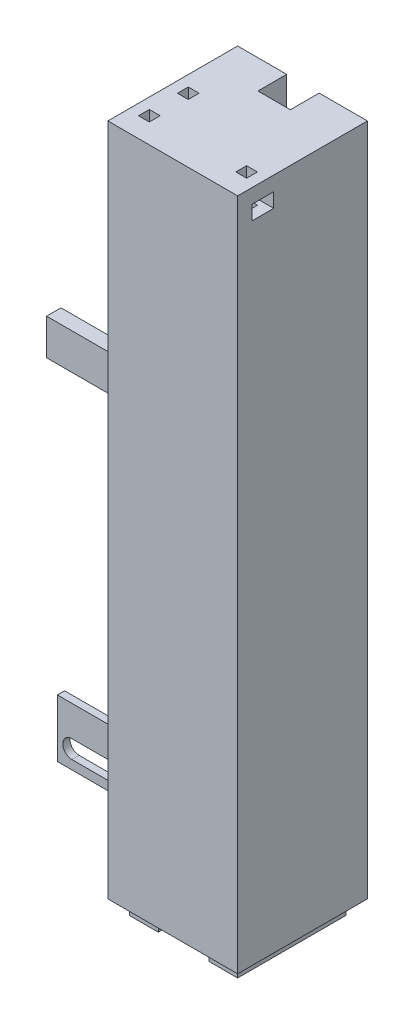
from build123d import *

# Parameters (mm, degrees)
SKETCH1_W           = 36
SKETCH1_H           = 36
BOSS_EXTRUDE1_DEPTH = 186.9
BOSS_EXTRUDE2_DEPTH = 4
SKETCH3_R           = 2
CUT_EXTRUDE1_DEPTH  = 5
SKETCH4_W           = 9
SKETCH4_H           = 186.9
CUT_EXTRUDE2_DEPTH  = 8
SKETCH5_W           = 6
SKETCH5_H           = 4
CUT_EXTRUDE3_DEPTH  = 9
SKETCH6_W           = 3
SKETCH6_H           = 3
CUT_EXTRUDE4_DEPTH  = 10
SKETCH7_W           = 2
SKETCH7_H           = 16
BOSS_EXTRUDE3_DEPTH = 40
CUT_EXTRUDE5_REACH  = 194.893
SKETCH9_W           = 4
SKETCH9_H           = 10
BOSS_EXTRUDE4_DEPTH = 45
CHAMFER1_SIZE       = 20
CUT_EXTRUDE6_DEPTH  = 27
SKETCH11_W          = 6
SKETCH11_H          = 4
SKETCH11_H_2        = 6
CUT_EXTRUDE7_DEPTH  = 9
SKETCH12_W          = 3
SKETCH12_H          = 3
CUT_EXTRUDE8_DEPTH  = 10


with BuildPart() as part:
    # Sketch1 → Boss-Extrude1 (new body)
    with BuildSketch(Plane(origin=(0, 0, 0), x_dir=(1, 0, 0), z_dir=(0, 1, 0))):
        with Locations((18, 18)):
            Rectangle(SKETCH1_W, SKETCH1_H)
    extrude(amount=BOSS_EXTRUDE1_DEPTH)

    # Sketch2 → Boss-Extrude2 (add)
    with BuildSketch(Plane.XZ):
        Polygon((3, -3), (7, -3), (11, -3), (11, -11), (7, -11), (7, -25), (11, -25), (11, -33), (7, -33), (3, -33), align=None)
        Polygon((29, -3), (33, -3), (33, -33), (29, -33), (25, -33), (25, -25), (29, -25), (29, -11), (25, -11), (25, -3), align=None)
    extrude(amount=BOSS_EXTRUDE2_DEPTH)

    # Sketch3 → Cut-Extrude1 (cut)
    with BuildSketch(Plane.XZ):
        with Locations((18, -18)):
            Circle(SKETCH3_R)
    extrude(amount=-CUT_EXTRUDE1_DEPTH, mode=Mode.SUBTRACT)

    # Sketch4 → Cut-Extrude2 (cut)
    with BuildSketch(Plane.XY.offset(-36)):
        with Locations((18.12, 93.45)):
            Rectangle(SKETCH4_W, SKETCH4_H)
    extrude(amount=CUT_EXTRUDE2_DEPTH, mode=Mode.SUBTRACT)

    # Sketch5 → Cut-Extrude3 (cut)
    with BuildSketch(Plane(origin=(36, 0, 0), x_dir=(0, 0, -1), z_dir=(1, 0, 0))):
        with Locations((7, 180.9)):
            Rectangle(SKETCH5_W, SKETCH5_H)
    extrude(amount=-CUT_EXTRUDE3_DEPTH, mode=Mode.SUBTRACT)

    # Sketch6 → Cut-Extrude4 (cut)
    with BuildSketch(Plane(origin=(0, 186.9, 0), x_dir=(1, 0, 0), z_dir=(0, 1, 0))):
        with Locations((31.5, 7)):
            Rectangle(SKETCH6_W, SKETCH6_H)
    extrude(amount=-CUT_EXTRUDE4_DEPTH, mode=Mode.SUBTRACT)

    # Sketch7 → Boss-Extrude3 (add)
    with BuildSketch(Plane.ZY):
        with Locations((-27, 8)):
            Rectangle(SKETCH7_W, SKETCH7_H)
    extrude(amount=BOSS_EXTRUDE3_DEPTH)

    # Sketch8 → Cut-Extrude5 (cut, up to next)
    with BuildSketch(Plane.XY.offset(-26), mode=Mode.PRIVATE) as cut_extrude5_sk1:
        with BuildLine():
            Line((-36, 7.5), (-12, 7.5))
            ThreePointArc((-12, 7.5), (-9.5, 5), (-12, 2.5))
            Line((-12, 2.5), (-36, 2.5))
            ThreePointArc((-36, 2.5), (-38.5, 5), (-36, 7.5))
        make_face()
    cut_extrude5_tool1 = extrude(cut_extrude5_sk1.sketch, amount=-CUT_EXTRUDE5_REACH, mode=Mode.PRIVATE) & part.part
    add(cut_extrude5_tool1.solids().sort_by_distance((-24, 5, -26))[0], mode=Mode.SUBTRACT)

    # Sketch9 → Boss-Extrude4 (add)
    with BuildSketch(Plane.ZY):
        with Locations((-30, 98.5)):
            Rectangle(SKETCH9_W, SKETCH9_H)
    extrude(amount=BOSS_EXTRUDE4_DEPTH)

    # Chamfer1
    chamfer1_edges = [part.edges().sort_by_distance(p)[0] for p in [
        (0, 93.5, -30),
        (0, 16, -27),
    ]]
    chamfer(chamfer1_edges, length=CHAMFER1_SIZE)

    # Sketch10 → Cut-Extrude6 (cut)
    with BuildSketch(Plane.XY.offset(-26)):
        Polygon((-17.171572875, 93.5), (-2, 78.328427125), (-2, 93.5), align=None)
        Polygon((-17.171572875, 16), (-2, 31.171572875), (-2, 16), align=None)
    extrude(amount=-CUT_EXTRUDE6_DEPTH, mode=Mode.SUBTRACT)

    # Sketch11 → Cut-Extrude7 (cut)
    with BuildSketch(Plane.ZY):
        with Locations((-7, 180.9)):
            Rectangle(SKETCH11_W, SKETCH11_H)
        with Locations((-17.8, 180.9)):
            Rectangle(SKETCH11_W, SKETCH11_H)
        with Locations((-13, 169.9)):
            Rectangle(SKETCH11_W, SKETCH11_H_2)
    extrude(amount=-CUT_EXTRUDE7_DEPTH, mode=Mode.SUBTRACT)

    # Sketch12 → Cut-Extrude8 (cut)
    with BuildSketch(Plane(origin=(0, 186.9, 0), x_dir=(1, 0, 0), z_dir=(0, 1, 0))):
        with Locations((4.5, 7)):
            Rectangle(SKETCH12_W, SKETCH12_H)
        with Locations((4.5, 17.8)):
            Rectangle(SKETCH12_W, SKETCH12_H)
    extrude(amount=-CUT_EXTRUDE8_DEPTH, mode=Mode.SUBTRACT)


solid = part.part
